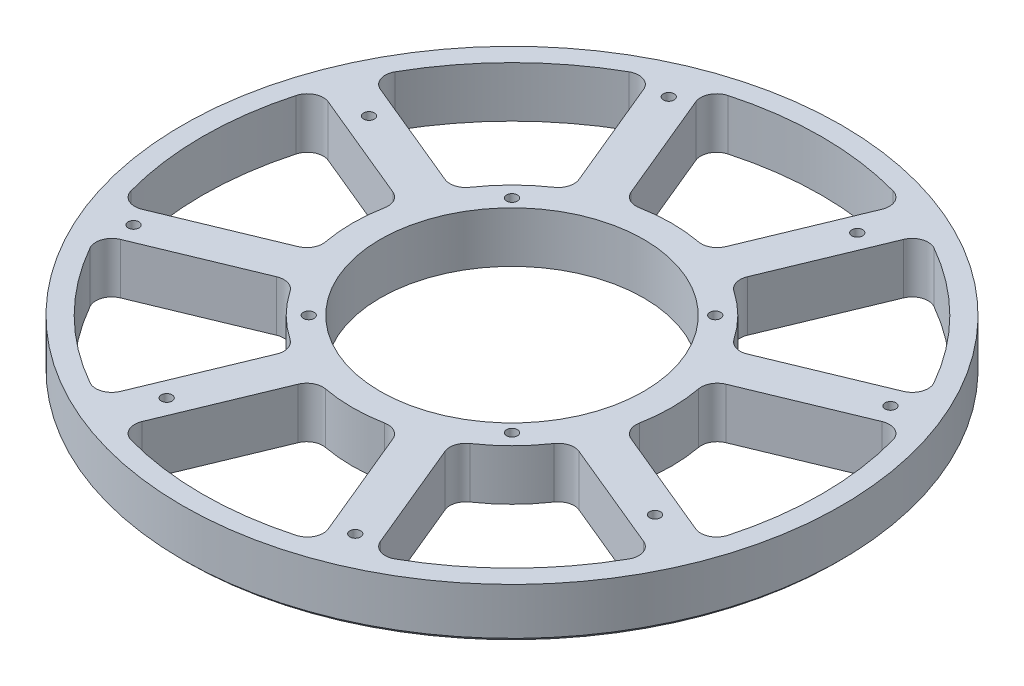
from build123d import *

# Parameters (mm, degrees)
SKETCH2_W                = 82.55
SKETCH2_H                = 12.7
F_6_32_TAPPED_HOLE1_D    = 2.7051
CIRPATTERN3_COUNT        = 4
CUT_EXTRUDE1_DEPTH       = 118.432086757
FILLET1_R                = 4
CIRPATTERN4_COUNT        = 8
FILLET1_OF_CIRPATTERN4_R = 4
CHAMFER2_SIZE            = 1
SKETCH9_R                = 33
CUT_EXTRUDE2_DEPTH       = 118.432086757


with BuildPart() as part:
    # Sketch2 → Revolve1 (revolve)
    with BuildSketch(Plane(origin=(0, 0, 0), x_dir=(0, 0, -1), z_dir=(1, 0, 0))):
        with Locations((-41.275, 6.35)):
            Rectangle(SKETCH2_W, SKETCH2_H)
    revolve(axis=Axis((0, -0.5, 0), (0, 1, 0)))

    # #6-32 Tapped Hole1 (through all)
    with Locations(Plane(origin=(0, 12.7, 0), x_dir=(1, 0, 0), z_dir=(0, 1, 0))):
        with Locations((-27.763683018, 67.027460084), (-61.160825052, 25.333643223), (-25.455844123, 25.455844123)):
            f_6_32_tapped_hole1 = Hole(F_6_32_TAPPED_HOLE1_D / 2)

    # CirPattern3: #6-32 Tapped Hole1 ×4 about axis
    cirpattern3_axis = Axis((0, -0.5, 0), (0, 1, 0))
    for i in range(1, CIRPATTERN3_COUNT):
        add(f_6_32_tapped_hole1.rotate(cirpattern3_axis, i * 360 / CIRPATTERN3_COUNT), mode=Mode.SUBTRACT)

    # Sketch8 → Cut-Extrude1 (cut, through all)
    with BuildSketch(Plane(origin=(0, 12.7, 0), x_dir=(1, 0, 0), z_dir=(0, 1, 0))):
        with BuildLine():
            Line((-10.567880231, 38.578749428), (-24.995954941, 73.411203073))
            ThreePointArc((-24.995954941, 73.411203073), (0, 77.55), (24.995954941, 73.411203073))
            Line((24.995954941, 73.411203073), (10.567880231, 38.578749428))
            ThreePointArc((10.567880231, 38.578749428), (0, 40), (-10.567880231, 38.578749428))
        make_face()
    cut_extrude1 = extrude(amount=-CUT_EXTRUDE1_DEPTH, mode=Mode.SUBTRACT)

    # Fillet1
    fillet1_edges = [part.edges().sort_by_distance(p)[0] for p in [
        (10.567880231, 6.35, -38.578749428),
        (24.995954941, 6.35, -73.411203073),
        (-10.567880231, 6.35, -38.578749428),
        (-24.995954941, 6.35, -73.411203073),
    ]]
    fillet(fillet1_edges, radius=FILLET1_R)

    # CirPattern4: Cut-Extrude1 ×8 about axis
    cirpattern4_axis = Axis((0, -0.5, 0), (0, 1, 0))
    for i in range(1, CIRPATTERN4_COUNT):
        add(cut_extrude1.rotate(cirpattern4_axis, i * 360 / CIRPATTERN4_COUNT), mode=Mode.SUBTRACT)

    # Fillet1 of CirPattern4
    fillet1_of_cirpattern4_edges = [part.edges().sort_by_distance(p)[0] for p in [
        (-19.806675556, 6.35, -34.751915104),
        (-34.234750266, 6.35, -69.584368749),
        (-34.751915104, 6.35, -19.806675556),
        (-69.584368749, 6.35, -34.234750266),
        (-38.578749428, 6.35, -10.567880231),
        (-73.411203073, 6.35, -24.995954941),
        (-38.578749428, 6.35, 10.567880231),
        (-73.411203073, 6.35, 24.995954941),
        (-34.751915104, 6.35, 19.806675556),
        (-69.584368749, 6.35, 34.234750266),
        (-19.806675556, 6.35, 34.751915104),
        (-34.234750266, 6.35, 69.584368749),
        (-10.567880231, 6.35, 38.578749428),
        (-24.995954941, 6.35, 73.411203073),
        (10.567880231, 6.35, 38.578749428),
        (24.995954941, 6.35, 73.411203073),
        (19.806675556, 6.35, 34.751915104),
        (34.234750266, 6.35, 69.584368749),
        (34.751915104, 6.35, 19.806675556),
        (69.584368749, 6.35, 34.234750266),
        (38.578749428, 6.35, 10.567880231),
        (73.411203073, 6.35, 24.995954941),
        (38.578749428, 6.35, -10.567880231),
        (73.411203073, 6.35, -24.995954941),
        (34.751915104, 6.35, -19.806675556),
        (69.584368749, 6.35, -34.234750266),
        (19.806675556, 6.35, -34.751915104),
        (34.234750266, 6.35, -69.584368749),
    ]]
    fillet(fillet1_of_cirpattern4_edges, radius=FILLET1_OF_CIRPATTERN4_R)

    # Chamfer2
    chamfer2_edges = [part.edges().sort_by_distance(p)[0] for p in [
        (0, 0, -82.55),
    ]]
    chamfer(chamfer2_edges, length=CHAMFER2_SIZE)

    # Sketch9 → Cut-Extrude2 (cut, through all)
    with BuildSketch(Plane(origin=(0, 12.7, 0), x_dir=(1, 0, 0), z_dir=(0, 1, 0))):
        Circle(SKETCH9_R)
    extrude(amount=-CUT_EXTRUDE2_DEPTH, mode=Mode.SUBTRACT)


solid = part.part
